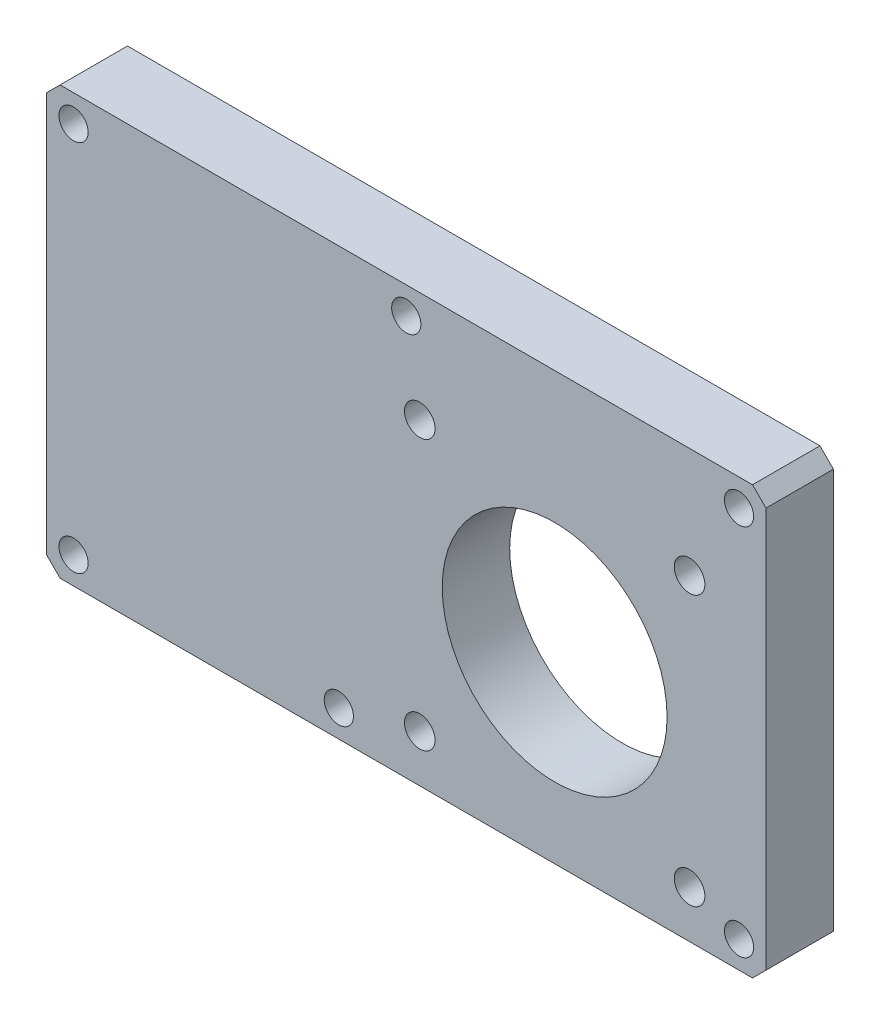
from build123d import *

# Parameters (mm, degrees)
SKETCH_1_W             = 160
SKETCH_1_H             = 95
EXTRUDE_1_DEPTH        = 15
CHAMFER_1_SIZE         = 3
SKETCH_2_R             = 25
CUT_EXTRUDE_1_DEPTH    = 187.681547026
HOLE_WIZARD_M8_1_D     = 6.8
HOLE_WIZARD_M8_1_DEPTH = 20
HOLE_WIZARD_M8_1_TIP   = 2.042926105
SKETCH_6_R             = 5.25
CUT_EXTRUDE_2_DEPTH    = 7
SKETCH_7_R             = 3.25
CUT_EXTRUDE_3_DEPTH    = 187.249832215


with BuildPart() as part:
    # 草图1 → 凸台-拉伸1 (new body)
    with BuildSketch(Plane.XY):
        with Locations((80, -47.5)):
            Rectangle(SKETCH_1_W, SKETCH_1_H)
    extrude(amount=EXTRUDE_1_DEPTH)

    # 倒角1
    chamfer_1_edges = [part.edges().sort_by_distance(p)[0] for p in [
        (160, -95, 7.5),
        (160, 0, 7.5),
        (0, -95, 7.5),
        (0, 0, 7.5),
    ]]
    chamfer(chamfer_1_edges, length=CHAMFER_1_SIZE)

    # 草图2 → 切除-拉伸1 (cut, through all)
    with BuildSketch(Plane(origin=(0, 0, 0), x_dir=(-1, 0, 0), z_dir=(0, 0, -1))):
        with Locations((-113, -54.25)):
            Circle(SKETCH_2_R)
    extrude(amount=-CUT_EXTRUDE_1_DEPTH, mode=Mode.SUBTRACT)

    # M8 螺纹孔1
    with Locations(Plane(origin=(0, 0, 0), x_dir=(-1, 0, 0), z_dir=(0, 0, -1))):
        with Locations((-143, -24.5), (-83, -24.5), (-83, -84.5), (-143, -84.5)):
            Hole(HOLE_WIZARD_M8_1_D / 2, depth=HOLE_WIZARD_M8_1_DEPTH)
            with Locations((0, 0, -(HOLE_WIZARD_M8_1_DEPTH + HOLE_WIZARD_M8_1_TIP / 2))):  # 118° drill point
                Cone(0, HOLE_WIZARD_M8_1_D / 2, HOLE_WIZARD_M8_1_TIP, mode=Mode.SUBTRACT)

    # 草图6 → 切除-拉伸2 (cut)
    with BuildSketch(Plane(origin=(0, 0, 0), x_dir=(-1, 0, 0), z_dir=(0, 0, -1))):
        with Locations((-154, -6)):
            Circle(SKETCH_6_R)
        with Locations((-80, -6)):
            Circle(SKETCH_6_R)
        with Locations((-6, -6)):
            Circle(SKETCH_6_R)
        with Locations((-6, -89)):
            Circle(SKETCH_6_R)
        with Locations((-154, -89)):
            Circle(SKETCH_6_R)
        with Locations((-65, -89)):
            Circle(SKETCH_6_R)
    extrude(amount=-CUT_EXTRUDE_2_DEPTH, mode=Mode.SUBTRACT)

    # 草图7 → 切除-拉伸3 (cut, through all)
    with BuildSketch(Plane(origin=(0, 0, 7), x_dir=(-1, 0, 0), z_dir=(0, 0, -1))):
        with Locations((-154, -6)):
            Circle(SKETCH_7_R)
        with Locations((-80, -6)):
            Circle(SKETCH_7_R)
        with Locations((-6, -6)):
            Circle(SKETCH_7_R)
        with Locations((-6, -89)):
            Circle(SKETCH_7_R)
        with Locations((-154, -89)):
            Circle(SKETCH_7_R)
        with Locations((-65, -89)):
            Circle(SKETCH_7_R)
    extrude(amount=-CUT_EXTRUDE_3_DEPTH, mode=Mode.SUBTRACT)


solid = part.part
